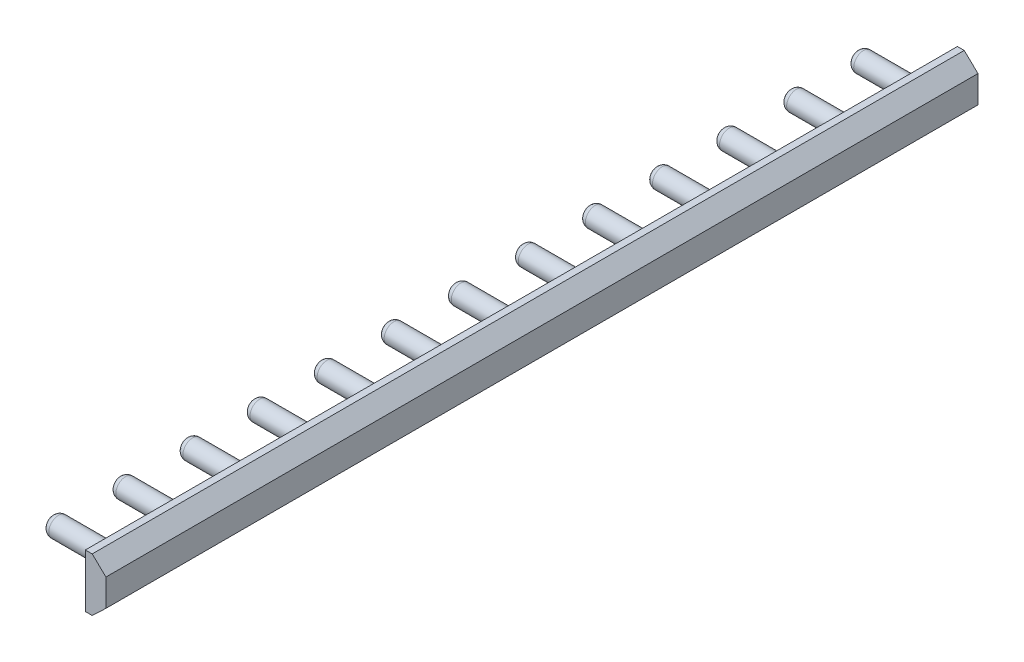
from build123d import *

# Parameters (mm, degrees)
BOSS_EXTRUDE1_DEPTH = 260
SKETCH2_R           = 2.9
BOSS_EXTRUDE2_DEPTH = 20
FILLET2_R           = 2


with BuildPart() as part:
    # Sketch1 → Boss-Extrude1 (new body)
    with BuildSketch(Plane.XY):
        Polygon((0, 7.95), (2.04, 7.95), (6.152414984, 4.048), (6.152414984, -4.048), (2.04, -7.95), (0, -7.95), align=None)
    extrude(amount=BOSS_EXTRUDE1_DEPTH)

    # Sketch2 → Boss-Extrude2 (add)
    with BuildSketch(Plane.ZY):
        with Locations((10, 0)):
            Circle(SKETCH2_R)
        with Locations((30, 0)):
            Circle(SKETCH2_R)
        with Locations((50, 0)):
            Circle(SKETCH2_R)
        with Locations((70, 0)):
            Circle(SKETCH2_R)
        with Locations((90, 0)):
            Circle(SKETCH2_R)
        with Locations((110, 0)):
            Circle(SKETCH2_R)
        with Locations((130, 0)):
            Circle(SKETCH2_R)
        with Locations((150, 0)):
            Circle(SKETCH2_R)
        with Locations((170, 0)):
            Circle(SKETCH2_R)
        with Locations((190, 0)):
            Circle(SKETCH2_R)
        with Locations((210, 0)):
            Circle(SKETCH2_R)
        with Locations((230, 0)):
            Circle(SKETCH2_R)
        with Locations((250, 0)):
            Circle(SKETCH2_R)
    extrude(amount=BOSS_EXTRUDE2_DEPTH)

    # Fillet2
    fillet2_edges = [part.edges().sort_by_distance(p)[0] for p in [
        (-20, 0, 7.1),
        (-20, 0, 247.1),
        (-20, 0, 227.1),
        (-20, 0, 207.1),
        (-20, 0, 187.1),
        (-20, 0, 167.1),
        (-20, 0, 147.1),
        (-20, 0, 127.1),
        (-20, 0, 107.1),
        (-20, 0, 87.1),
        (-20, 0, 67.1),
        (-20, 0, 47.1),
        (-20, 0, 27.1),
    ]]
    fillet(fillet2_edges, radius=FILLET2_R)


solid = part.part
